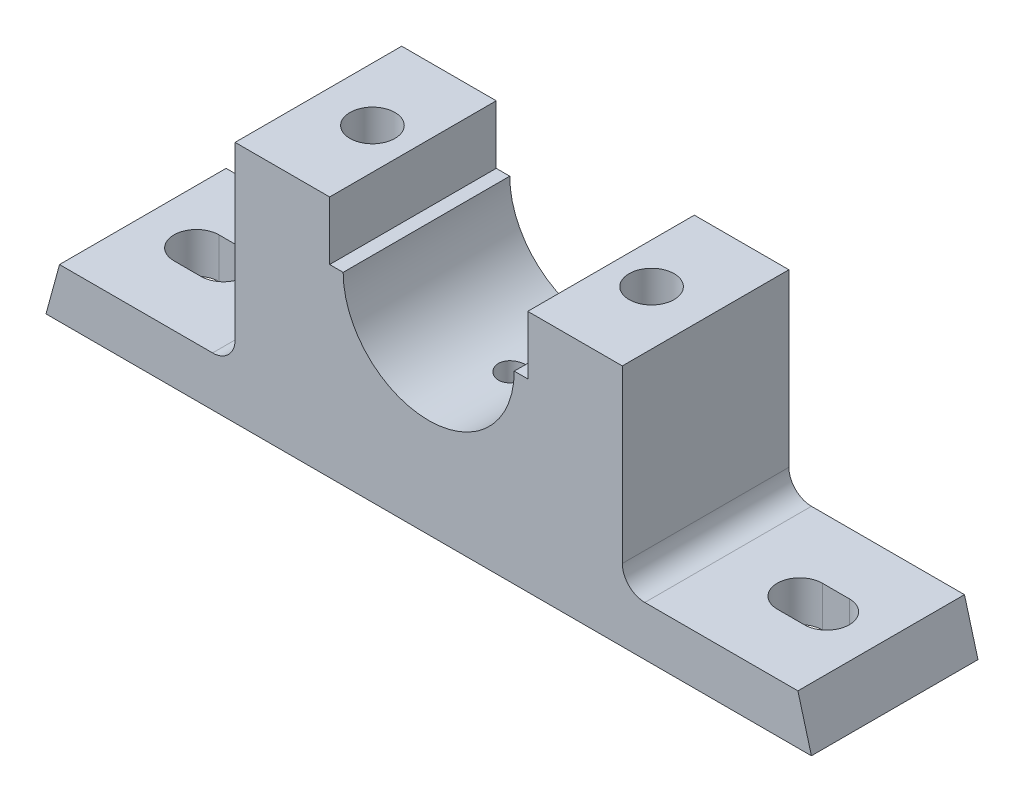
from build123d import *

# Parameters (mm, degrees)
BOSS_EXTRUDE1_DEPTH     = 37
SKETCH2_W               = 73
SKETCH2_H               = 22
CUT_EXTRUDE2_DEPTH      = 2
CHAMFER1_SIZE           = 2
CHAMFER2_SIZE           = 2
CHAMFER3_SIZE           = 2
CHAMFER4_SIZE           = 2
SKETCH3_W               = 20
SKETCH3_H               = 20
CUT_EXTRUDE4_DEPTH      = 8
CUT_EXTRUDE5_DEPTH      = 107.292050502
SKETCH6_R               = 5
CUT_EXTRUDE6_DEPTH      = 108.284668057
CUT_EXTRUDE7_DEPTH      = 21
CUT_EXTRUDE7_DEPTH_BACK = 2
SKETCH8_R               = 3


with BuildPart() as part:
    # Sketch1 → Boss-Extrude1 (new body)
    with BuildSketch(Plane.XY):
        with BuildLine():
            Line((85, 0), (-85, 0))
            Line((-85, 0), (-82, 11))
            Line((-82, 11), (-48, 11))
            ThreePointArc((-48, 11), (-44.464466094, 12.464466094), (-43, 16))
            Line((-43, 16), (-43, 54))
            Line((-43, 54), (-22, 54))
            Line((-22, 54), (-22, 41))
            Line((-22, 41), (-19, 41))
            ThreePointArc((-19, 41), (0, 22), (19, 41))
            Line((19, 41), (22, 41))
            Line((22, 41), (22, 54))
            Line((22, 54), (43, 54))
            Line((43, 54), (43, 16))
            ThreePointArc((43, 16), (44.464466094, 12.464466094), (48, 11))
            Line((48, 11), (82, 11))
            Line((82, 11), (85, 0))
        make_face()
    extrude(amount=BOSS_EXTRUDE1_DEPTH)

    # Sketch2 → Cut-Extrude2 (cut)
    with BuildSketch(Plane(origin=(0, 0, 0), x_dir=(1, 0, 0), z_dir=(0, 1, 0))):
        with Locations((-40.5, -18.5)):
            Rectangle(SKETCH2_W, SKETCH2_H)
        with Locations((40.5, -18.5)):
            Rectangle(SKETCH2_W, SKETCH2_H)
    extrude(amount=CUT_EXTRUDE2_DEPTH, mode=Mode.SUBTRACT)

    # Chamfer1
    chamfer1_edges = [part.edges().sort_by_distance(p)[0] for p in [
        (-77, 2, 18.5),
    ]]
    chamfer(chamfer1_edges, length=CHAMFER1_SIZE - 0.0001)  # a hair under: the kernel refuses the full size

    # Chamfer2
    chamfer2_edges = [part.edges().sort_by_distance(p)[0] for p in [
        (4, 2, 18.5),
    ]]
    chamfer(chamfer2_edges, length=CHAMFER2_SIZE - 0.0001)  # a hair under: the kernel refuses the full size

    # Chamfer3
    chamfer3_edges = [part.edges().sort_by_distance(p)[0] for p in [
        (-4, 2, 18.5),
    ]]
    chamfer(chamfer3_edges, length=CHAMFER3_SIZE - 0.0001)  # a hair under: the kernel refuses the full size

    # Chamfer4
    chamfer4_edges = [part.edges().sort_by_distance(p)[0] for p in [
        (77, 2, 18.5),
    ]]
    chamfer(chamfer4_edges, length=CHAMFER4_SIZE - 0.0001)  # a hair under: the kernel refuses the full size

    # Sketch3 → Cut-Extrude4 (cut)
    with BuildSketch(Plane(origin=(0, 0, 0), x_dir=(1, 0, 0), z_dir=(0, 1, 0))):
        with Locations((-31, -18.5)):
            Rectangle(SKETCH3_W, SKETCH3_H)
        with Locations((31, -18.5)):
            Rectangle(SKETCH3_W, SKETCH3_H)
    extrude(amount=CUT_EXTRUDE4_DEPTH, mode=Mode.SUBTRACT)

    # Sketch5 → Cut-Extrude5 (cut, through all)
    with BuildSketch(Plane.XZ.offset(-2)):
        with BuildLine():
            Line((70, 23.582105154), (64, 23.582105154))
            ThreePointArc((64, 23.582105154), (59, 18.582105154), (64, 13.582105154))
            Line((64, 13.582105154), (70, 13.582105154))
            ThreePointArc((70, 13.582105154), (75, 18.582105154), (70, 23.582105154))
        make_face()
        with BuildLine():
            Line((-70, 23.582105154), (-64, 23.582105154))
            ThreePointArc((-64, 23.582105154), (-59, 18.582105154), (-64, 13.582105154))
            Line((-64, 13.582105154), (-70, 13.582105154))
            ThreePointArc((-70, 13.582105154), (-75, 18.582105154), (-70, 23.582105154))
        make_face()
    extrude(amount=-CUT_EXTRUDE5_DEPTH, mode=Mode.SUBTRACT)

    # Sketch6 → Cut-Extrude6 (cut, through all)
    with BuildSketch(Plane(origin=(0, 54, 0), x_dir=(1, 0, 0), z_dir=(0, 1, 0))):
        with Locations(Location((-31, -18.5, 0), (0, 0, 270))):
            Circle(SKETCH6_R)
        with Locations(Location((31, -18.5, 0), (0, 0, 270))):
            Circle(SKETCH6_R)
    extrude(amount=-CUT_EXTRUDE6_DEPTH, mode=Mode.SUBTRACT)

    # Sketch8 → Cut-Extrude7 (cut, two sides: drawn at the far end of the back side and taken through both)
    with BuildSketch(Plane(origin=(0, 16, 0), x_dir=(1, 0, 0), z_dir=(0, 1, 0)).offset(-CUT_EXTRUDE7_DEPTH_BACK)):
        with Locations(Location((0, -18.5, 0), (0, 0, 270))):
            Circle(SKETCH8_R)
    extrude(amount=CUT_EXTRUDE7_DEPTH + CUT_EXTRUDE7_DEPTH_BACK, mode=Mode.SUBTRACT)


solid = part.part
